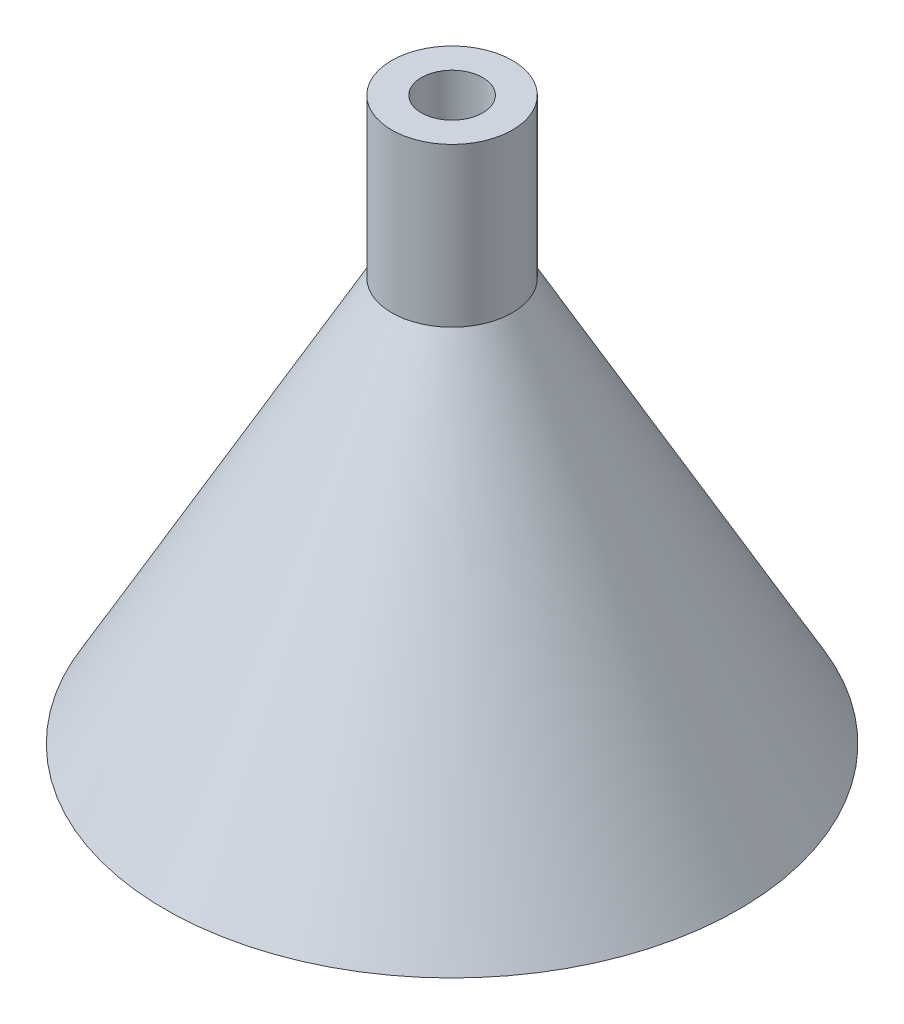
from build123d import *


with BuildPart() as part:
    # Sketch2 → Revolve1 (revolve)
    with BuildSketch(Plane.XY):
        Polygon((22.117699019, 0), (29, 0), (6.096, 40.762187618), (6.096, 56.762187618), (3.096, 56.762187618), (3.096, 33.852866933), align=None)
    revolve(axis=Axis((0, 0, 0), (0, 1, 0)))


solid = part.part
